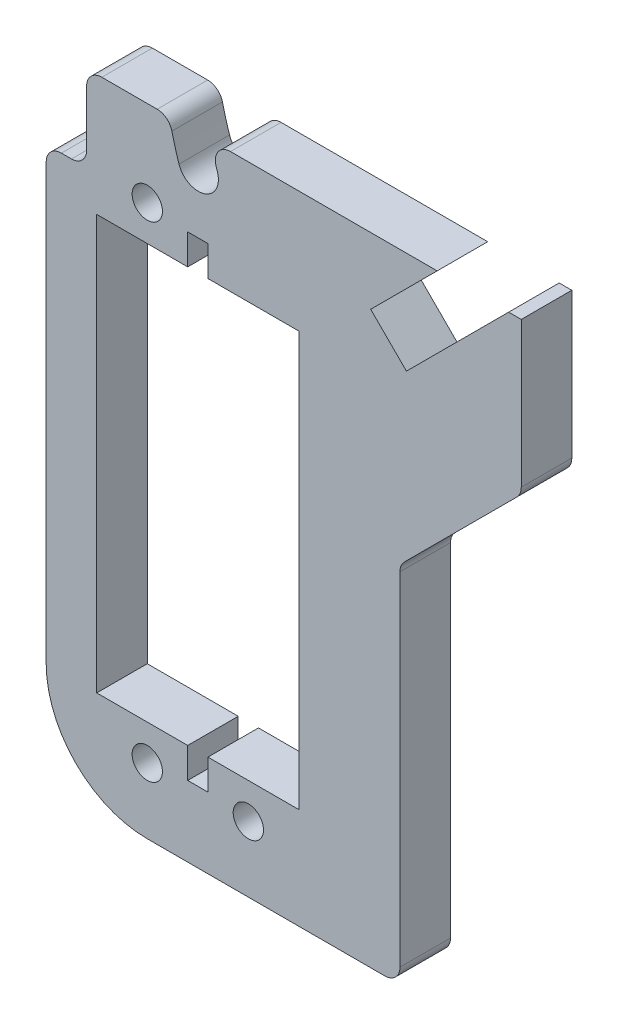
from build123d import *

# Parameters (mm, degrees)
ESQUISSE1_R        = 1.5
BOSS_EXTRU_1_DEPTH = 5
CONG_2_R           = 10
CONG_3_R           = 1.5


with BuildPart() as part:
    # Esquisse1 → Boss.-Extru.1 (new body)
    with BuildSketch(Plane.XY):
        with BuildLine():
            Line((0, 54.5), (0, 0))
            Line((0, 0), (35, 0))
            Line((35, 0), (35, 36))
            Line((35, 36), (47, 48))
            Line((47, 48), (47, 63))
            Line((47, 63), (45.752159395, 63))
            Line((45.752159395, 63), (35.639535665, 52.88737627))
            Line((35.639535665, 52.88737627), (32.104001759, 56.422910176))
            Line((32.104001759, 56.422910176), (38.681091584, 63))
            Line((38.681091584, 63), (16.273544028, 63))
            ThreePointArc((16.273544028, 63), (16.579779278, 61.804862269), (16.938867642, 60.624527668))
            ThreePointArc((16.938867642, 60.624527668), (15.66340447, 58.10000916), (13.138885962, 59.375472332))
            ThreePointArc((13.138885962, 59.375472332), (12.606182876, 61.173571904), (12.180630225, 63))
            Line((12.180630225, 63), (4, 63))
            Line((4, 63), (4, 54.5))
            Line((4, 54.5), (0, 54.5))
        make_face()
        with Locations((10, 6.5)):
            Circle(ESQUISSE1_R, mode=Mode.SUBTRACT)
        with Locations((20, 6.5)):
            Circle(ESQUISSE1_R, mode=Mode.SUBTRACT)
        Polygon((5, 51), (14, 51), (14, 54), (16, 54), (16, 51), (25, 51), (25, 10), (16, 10), (16, 7), (14, 7), (14, 10), (5, 10), align=None, mode=Mode.SUBTRACT)
        with Locations((10, 54.5)):
            Circle(ESQUISSE1_R, mode=Mode.SUBTRACT)
    extrude(amount=BOSS_EXTRU_1_DEPTH)

    # Congé2
    cong_2_edges = [part.edges().sort_by_distance(p)[0] for p in [
        (0, 0, 2.5),
    ]]
    fillet(cong_2_edges, radius=CONG_2_R)

    # Congé3
    cong_3_edges = [part.edges().sort_by_distance(p)[0] for p in [
        (4, 54.5, 2.5),
        (0, 54.5, 2.5),
        (4, 63, 2.5),
        (16.273544028, 63, 2.5),
        (12.180630225, 63, 2.5),
        (47, 48, 2.5),
        (35, 0, 2.5),
        (35, 36, 2.5),
    ]]
    fillet(cong_3_edges, radius=CONG_3_R)


solid = part.part
